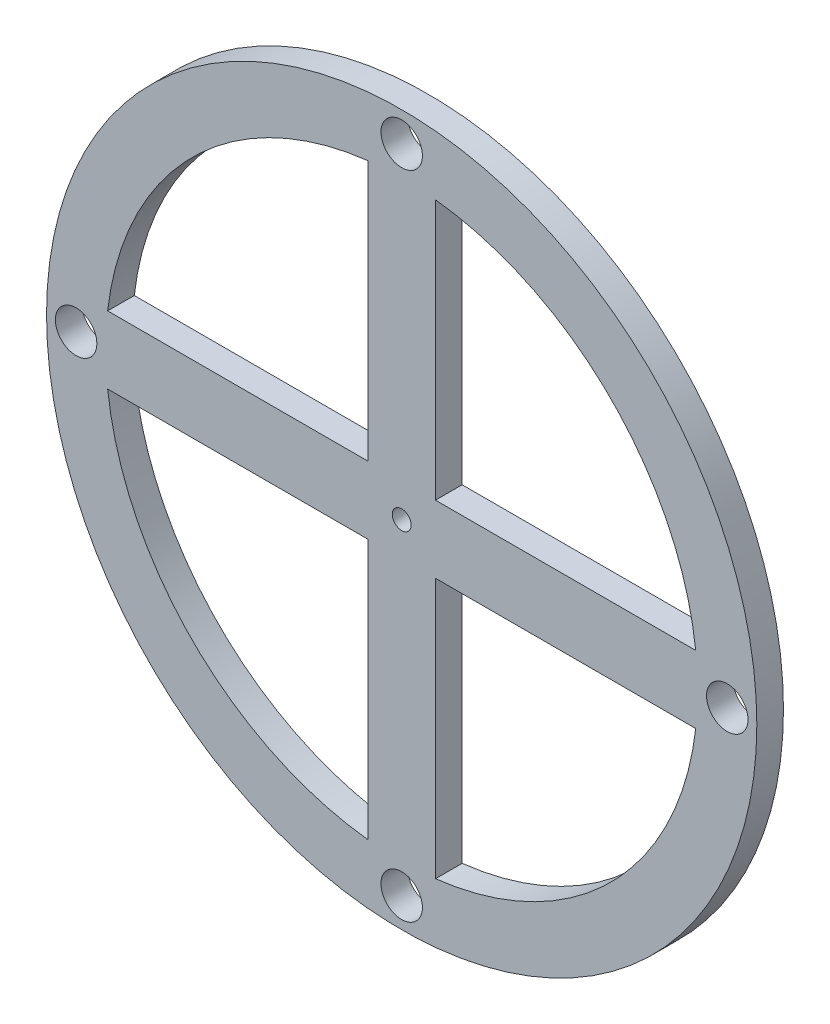
from build123d import *

# Parameters (mm, degrees)
ESQUISSE1_R        = 60
ESQUISSE1_R_2      = 1.595
ESQUISSE1_R_3      = 3.5
BOSS_EXTRU_4_DEPTH = 4.5


with BuildPart() as part:
    # Esquisse1 → Boss.-Extru.4 (new body)
    with BuildSketch(Plane.XY):
        Circle(ESQUISSE1_R)
        with BuildLine():
            Line((5.714285714, 5.714285714), (5.714285714, 49.672396145))
            ThreePointArc((5.714285714, 49.672396145), (35.355339059, 35.355339059), (49.672396145, 5.714285714))
            Line((49.672396145, 5.714285714), (5.714285714, 5.714285714))
        make_face(mode=Mode.SUBTRACT)
        with BuildLine():
            Line((5.714285714, -5.714285714), (49.672396145, -5.714285714))
            ThreePointArc((49.672396145, -5.714285714), (35.355339059, -35.355339059), (5.714285714, -49.672396145))
            Line((5.714285714, -49.672396145), (5.714285714, -5.714285714))
        make_face(mode=Mode.SUBTRACT)
        with BuildLine():
            Line((-5.714285714, -5.714285714), (-5.714285714, -49.672396145))
            ThreePointArc((-5.714285714, -49.672396145), (-35.355339059, -35.355339059), (-49.672396145, -5.714285714))
            Line((-49.672396145, -5.714285714), (-5.714285714, -5.714285714))
        make_face(mode=Mode.SUBTRACT)
        with BuildLine():
            Line((-5.714285714, 5.714285714), (-49.672396145, 5.714285714))
            ThreePointArc((-49.672396145, 5.714285714), (-35.355339059, 35.355339059), (-5.714285714, 49.672396145))
            Line((-5.714285714, 49.672396145), (-5.714285714, 5.714285714))
        make_face(mode=Mode.SUBTRACT)
        Circle(ESQUISSE1_R_2, mode=Mode.SUBTRACT)
        with Locations((0, -55)):
            Circle(ESQUISSE1_R_3, mode=Mode.SUBTRACT)
        with Locations((-55, 0)):
            Circle(ESQUISSE1_R_3, mode=Mode.SUBTRACT)
        with Locations((55, 0)):
            Circle(ESQUISSE1_R_3, mode=Mode.SUBTRACT)
        with Locations((0, 55)):
            Circle(ESQUISSE1_R_3, mode=Mode.SUBTRACT)
    extrude(amount=BOSS_EXTRU_4_DEPTH)


solid = part.part
